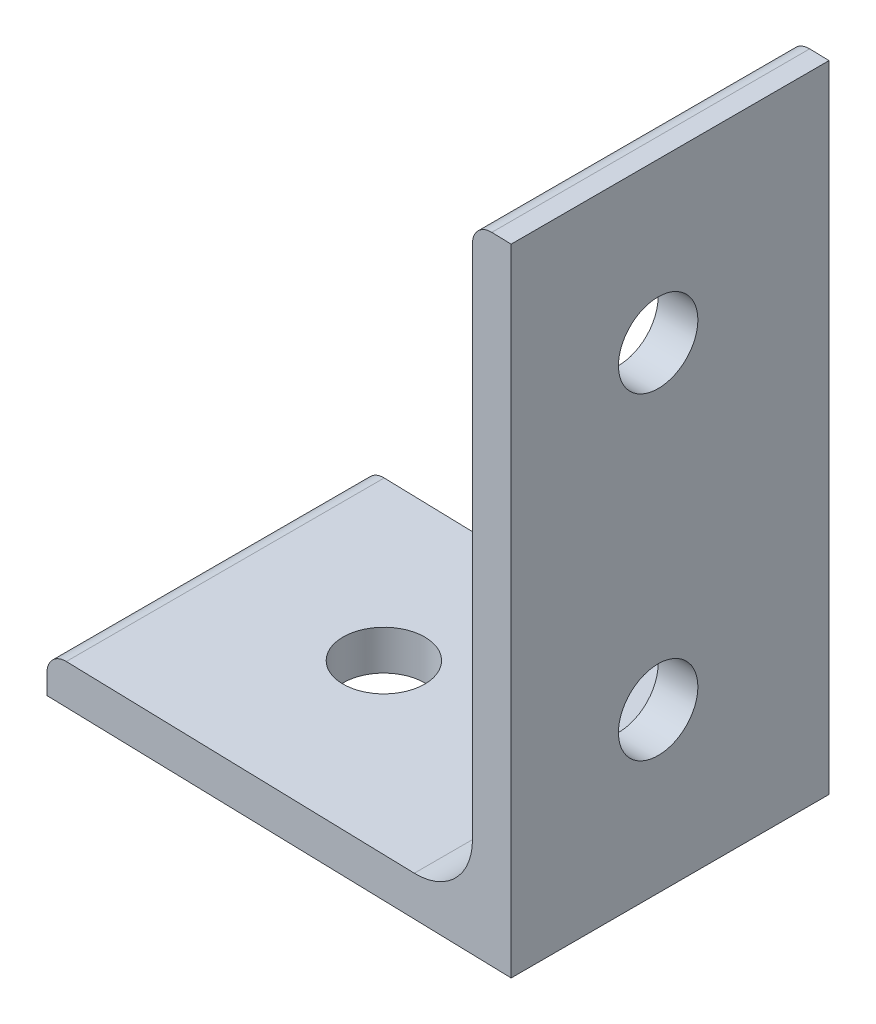
from build123d import *

# Parameters (mm, degrees)
BOSS_EXTRUDE1_DEPTH     = 15.875
SKETCH4_R               = 3.175
CUT_EXTRUDE1_DEPTH      = 49.464271634
SKETCH3_OUTSIDE_W       = 54.3
SKETCH3_OUTSIDE_H       = 47.95
CUT_EXTRUDE2_DEPTH      = 57.529267862
F_1_4_CLEARANCE_HOLE1_D = 6.5278
SKETCH9_R               = 6.35
CUT_EXTRUDE3_DEPTH      = 2.54


with BuildPart() as part:
    # Sketch2 → Boss-Extrude1 (new, symmetric)
    with BuildSketch(Plane.XY):
        with BuildLine():
            Line((-19.05, -25.4), (19.05, -25.4))
            Line((19.05, -25.4), (19.05, 25.4))
            Line((19.05, 25.4), (17.4625, 25.4))
            ThreePointArc((17.4625, 25.4), (16.339967985, 24.935032015), (15.875, 23.8125))
            Line((15.875, 23.8125), (15.875, -17.4498))
            ThreePointArc((15.875, -17.4498), (14.476376302, -20.826376302), (11.0998, -22.225))
            Line((11.0998, -22.225), (-17.4625, -22.225))
            ThreePointArc((-17.4625, -22.225), (-18.585032015, -22.689967985), (-19.05, -23.8125))
            Line((-19.05, -23.8125), (-19.05, -25.4))
        make_face()
    extrude(amount=BOSS_EXTRUDE1_DEPTH, both=True)

    # Sketch4 → Cut-Extrude1 (cut, through all)
    with BuildSketch(Plane(origin=(19.05, 0, 0), x_dir=(0, 0, -1), z_dir=(1, 0, 0))):
        with Locations((-3.175, 12.7)):
            Circle(SKETCH4_R)
        with Locations((-3.175, -12.7)):
            Circle(SKETCH4_R)
    extrude(amount=-CUT_EXTRUDE1_DEPTH, mode=Mode.SUBTRACT)

    # Sketch3 outside → Cut-Extrude2 (cut, through all)
    with BuildSketch(Plane.XZ.offset(25.4)):
        Rectangle(SKETCH3_OUTSIDE_W, SKETCH3_OUTSIDE_H)
        Polygon((-19.05, 13.926834826), (-19.05, -11.481872103), (19.05, -10.484188491), (19.05, 14.924518438), align=None, mode=Mode.SUBTRACT)
    extrude(amount=-CUT_EXTRUDE2_DEPTH, mode=Mode.SUBTRACT)

    # 1/4 Clearance Hole1 (through all)
    with Locations(Plane(origin=(0, -25.4, 0), x_dir=(-1, 0, 0), z_dir=(0, -1, 0))):
        with Locations((4.835548778, -1.212219908)):
            Hole(F_1_4_CLEARANCE_HOLE1_D / 2)

    # Sketch9 → Cut-Extrude3 (cut)
    with BuildSketch(Plane.ZY.offset(-15.875)):
        with Locations((3.175, -12.7)):
            Circle(SKETCH9_R)
    extrude(amount=CUT_EXTRUDE3_DEPTH, mode=Mode.SUBTRACT)


solid = part.part
